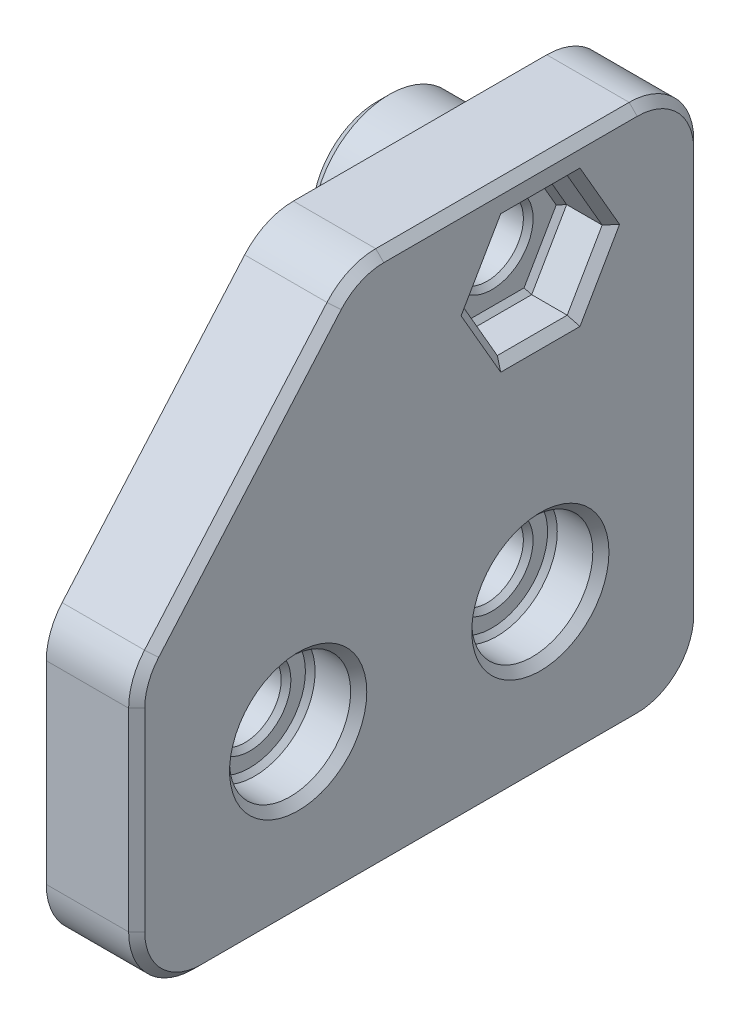
from build123d import *

# Parameters (mm, degrees)
SKETCH1_R           = 2.25
BOSS_EXTRUDE1_DEPTH = 2.6
SKETCH2_R           = 4.75
SKETCH2_R_2         = 2.5
BOSS_EXTRUDE2_DEPTH = 4.5
CHAMFER1_SIZE       = 0.75
SKETCH3_R           = 3.75
BOSS_EXTRUDE3_DEPTH = 3
CHAMFER2_SIZE       = 0.3
CHAMFER3_SIZE       = 0.5


with BuildPart() as part:
    # Sketch1 → Boss-Extrude1 (new body)
    with BuildSketch(Plane(origin=(0, 0, 0), x_dir=(0, 0, -1), z_dir=(1, 0, 0))):
        with BuildLine():
            Line((-21, -10), (6, -10))
            ThreePointArc((6, -10), (8.828427125, -8.828427125), (10, -6))
            Line((10, -6), (10, 19))
            ThreePointArc((10, 19), (8.828427125, 21.828427125), (6, 23))
            Line((6, 23), (-9.695652174, 23))
            ThreePointArc((-9.695652174, 23), (-11.354136506, 22.63997661), (-12.714074263, 21.62471486))
            Line((-12.714074263, 21.62471486), (-24.018422089, 8.62471486))
            ThreePointArc((-24.018422089, 8.62471486), (-24.746577662, 7.401126626), (-25, 6))
            Line((-25, 6), (-25, -6))
            ThreePointArc((-25, -6), (-23.828427125, -8.828427125), (-21, -10))
        make_face()
        with Locations((-15, 0)):
            Circle(SKETCH1_R, mode=Mode.SUBTRACT)
        with Locations((0, 17.25)):
            Circle(SKETCH1_R, mode=Mode.SUBTRACT)
        Circle(SKETCH1_R, mode=Mode.SUBTRACT)
    extrude(amount=BOSS_EXTRUDE1_DEPTH)

    # Sketch2 → Boss-Extrude2 (add)
    with BuildSketch(Plane.ZY):
        with Locations((0, 17.25)):
            Circle(SKETCH2_R)
        with Locations((0, 17.25)):
            Circle(SKETCH2_R_2, mode=Mode.SUBTRACT)
    extrude(amount=BOSS_EXTRUDE2_DEPTH)

    # Chamfer1
    chamfer1_edges = [part.edges().sort_by_distance(p)[0] for p in [
        (-4.5, 17.25, -4.75),
    ]]
    chamfer(chamfer1_edges, length=CHAMFER1_SIZE)

    # Sketch3 → Boss-Extrude3 (add)
    with BuildSketch(Plane(origin=(2.6, 0, 0), x_dir=(0, 0, -1), z_dir=(1, 0, 0))):
        with BuildLine():
            Line((-21, -10), (6, -10))
            ThreePointArc((6, -10), (8.828427125, -8.828427125), (10, -6))
            Line((10, -6), (10, 19))
            ThreePointArc((10, 19), (8.828427125, 21.828427125), (6, 23))
            Line((6, 23), (-9.695652174, 23))
            ThreePointArc((-9.695652174, 23), (-11.354136506, 22.63997661), (-12.714074263, 21.62471486))
            Line((-12.714074263, 21.62471486), (-24.018422089, 8.62471486))
            ThreePointArc((-24.018422089, 8.62471486), (-24.746577662, 7.401126626), (-25, 6))
            Line((-25, 6), (-25, -6))
            ThreePointArc((-25, -6), (-23.828427125, -8.828427125), (-21, -10))
        make_face()
        with Locations((-15, 0)):
            Circle(SKETCH3_R, mode=Mode.SUBTRACT)
        Circle(SKETCH3_R, mode=Mode.SUBTRACT)
        Polygon((2.165063509, 21), (-2.165063509, 21), (-4.330127019, 17.25), (-2.165063509, 13.5), (2.165063509, 13.5), (4.330127019, 17.25), align=None, mode=Mode.SUBTRACT)
    extrude(amount=BOSS_EXTRUDE3_DEPTH)

    # Chamfer2
    chamfer2_edges = [part.edges().sort_by_distance(p)[0] for p in [
        (2.6, 0, 18.75),
        (2.6, 0, 17.25),
        (2.6, 0, 3.75),
        (2.6, 0, 2.25),
        (2.6, 13.5, 0),
        (2.6, 15.375, 3.247595264),
        (2.6, 19.125, 3.247595264),
        (2.6, 21, 0),
        (2.6, 19.125, -3.247595264),
        (2.6, 15.375, -3.247595264),
        (2.6, 17.25, 2.25),
    ]]
    chamfer(chamfer2_edges, length=CHAMFER2_SIZE)

    # Chamfer3
    chamfer3_edges = [part.edges().sort_by_distance(p)[0] for p in [
        (5.6, 19.125, 3.247595264),
        (5.6, 15.375, 3.247595264),
        (5.6, 13.5, 0),
        (5.6, 15.375, -3.247595264),
        (5.6, 19.125, -3.247595264),
        (5.6, 21, 0),
        (5.6, 0, 3.75),
        (5.6, 0, 25),
        (5.6, 7.401126626, 24.746577662),
        (5.6, 15.12471486, 18.366248176),
        (5.6, 22.63997661, 11.354136506),
        (5.6, 23, 1.847826087),
        (5.6, 21.828427125, -8.828427125),
        (5.6, 6.5, -10),
        (5.6, -8.828427125, -8.828427125),
        (5.6, -10, 7.5),
        (5.6, -8.828427125, 23.828427125),
        (5.6, 0, 18.75),
    ]]
    chamfer(chamfer3_edges, length=CHAMFER3_SIZE)


solid = part.part
